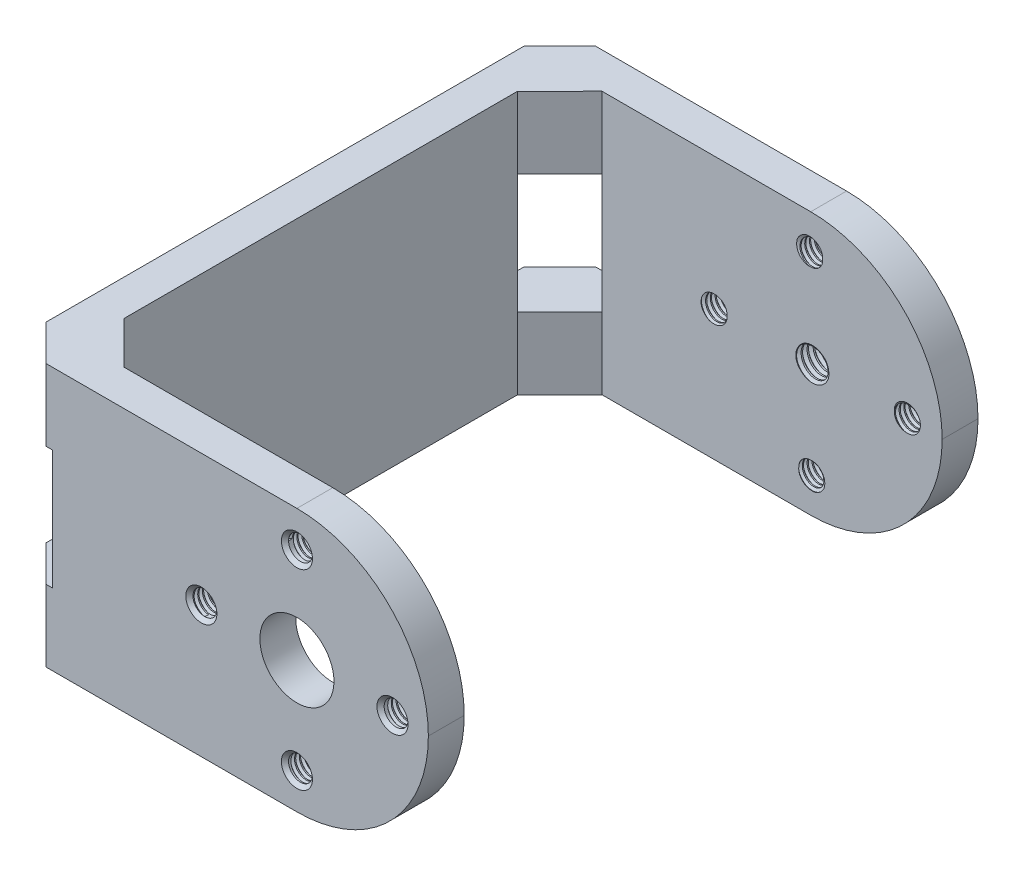
from build123d import *

# Parameters (mm, degrees)
IZIM1_W                                        = 46
IZIM1_H                                        = 22
Y_KSEKLIK_EKSTR_ZYON1_DEPTH                    = 35
IZIM2_W                                        = 40
IZIM2_H                                        = 22
KES_EKSTR_ZYON1_DEPTH                          = 32
RADYUS1_R                                      = 11
PAH1_SIZE                                      = 3
IZIM3_W                                        = 5
IZIM3_H                                        = 10
KES_EKSTR_ZYON2_DEPTH                          = 20
FEDER5_REACH                                   = 46.833
IZIM8_WALL_W                                   = 96.666047784
IZIM8_WALL_H                                   = 6
AYNALAMA4_COPY_1_REACH                         = 46.833
AYNALAMA4_COPY_1_SKETCH_W                      = 96.666047784
AYNALAMA4_COPY_1_SKETCH_H                      = 6
IZIM10_R                                       = 3.1
KES_EKSTR_ZYON4_DEPTH                          = 59.838762733
DI_1_PITCH                                     = 0.4
DAIRESEL_KAPLAMA1_COUNT                        = 4
DI_2_PITCH                                     = 0.4
DAIRESEL_KAPLAMA2_COUNT                        = 4
IZIM12_R                                       = 3.1
Y_KSEKLIK_EKSTR_ZYON3_DEPTH                    = 3
M3_D_Z_BA_L_MAKINE_VIDAS_IN_HAV_A1_D           = 2.5
M3_D_Z_BA_L_MAKINE_VIDAS_IN_HAV_A1_CSINK_D     = 3.1
M3_D_Z_BA_L_MAKINE_VIDAS_IN_HAV_A1_CSINK_ANGLE = 90
DI_4_PITCH                                     = 0.5


# Read off the part's stored shape, not the designer's step: M2 Düz Başlı Makine Vidası İçin Havşa1
with BuildPart() as part:
    # Çizim1 → Yükseklik-Ekstrüzyon1 (new body)
    with BuildSketch(Plane(origin=(0, 0, 0), x_dir=(0, 0, -1), z_dir=(1, 0, 0))):
        Rectangle(IZIM1_W, IZIM1_H)
    extrude(amount=Y_KSEKLIK_EKSTR_ZYON1_DEPTH)

    # Çizim2 → Kes-Ekstrüzyon1 (cut)
    with BuildSketch(Plane(origin=(35, 0, 0), x_dir=(0, 0, -1), z_dir=(1, 0, 0))):
        Rectangle(IZIM2_W, IZIM2_H)
    extrude(amount=-KES_EKSTR_ZYON1_DEPTH, mode=Mode.SUBTRACT)

    # Radyus1
    radyus1_edges = [part.edges().sort_by_distance(p)[0] for p in [
        (35, -11, 21.5),
        (35, 11, 21.5),
        (35, -11, -21.5),
        (35, 11, -21.5),
    ]]
    fillet(radyus1_edges, radius=RADYUS1_R - 0.0001)  # a hair under: the kernel refuses the full size

    # Pah1
    pah1_edges = [part.edges().sort_by_distance(p)[0] for p in [
        (0, 0, 23),
        (0, 0, -23),
    ]]
    chamfer(pah1_edges, length=PAH1_SIZE)

    # Çizim3 → Kes-Ekstrüzyon2 (cut)
    with BuildSketch(Plane(origin=(-10, 0, 10), x_dir=(0.7071067811865468, 0, 0.7071067811865483), z_dir=(-0.7071067811865483, 0, 0.7071067811865468))):
        with Locations((16.262135624, 0)):
            Rectangle(IZIM3_W, IZIM3_H)
    kes_ekstr_zyon2 = extrude(amount=-KES_EKSTR_ZYON2_DEPTH, mode=Mode.SUBTRACT)

    # M2 Düz Başlı Makine Vidası İçin Havşa1 ou → M2 Düz Başlı Makine Vidası İçin Havşa1 (revolve, cut)
    with BuildSketch(Plane(origin=(24, -8, 0), x_dir=(1, 0, 0), z_dir=(0, -1, 0))):
        Polygon((0, 20), (1, 20), (1, 22.7), (1.3, 23), (0, 23), align=None)
    m2_d_z_ba_l_makine_vidas_in_hav_a1 = revolve(axis=Axis((24, -8, 0), (0, 0, 1)), mode=Mode.SUBTRACT)

    # M2 D_z Ba_l_ Makine Vidas_ _in Hav_a 2 → M2 D_z Ba_l_ Makine Vidas_ _in Hav_a1 2 (revolve, cut)
    with BuildSketch(Plane(origin=(32, 0, 0), x_dir=(1, 0, 0), z_dir=(0, -1, 0))):
        Polygon((0, 20), (1, 20), (1, 22.7), (1.3, 23), (0, 23), align=None)
    m2_d_z_ba_l_makine_vidas_in_hav_a1_2 = revolve(axis=Axis((32, 0, 0), (0, 0, 1)), mode=Mode.SUBTRACT)

    # M2 D_z Ba_l_ Makine Vidas_ _in Hav_a 3 → M2 D_z Ba_l_ Makine Vidas_ _in Hav_a1 3 (revolve, cut)
    with BuildSketch(Plane(origin=(24, 8, 0), x_dir=(1, 0, 0), z_dir=(0, -1, 0))):
        Polygon((0, 20), (1, 20), (1, 22.7), (1.3, 23), (0, 23), align=None)
    m2_d_z_ba_l_makine_vidas_in_hav_a1_3 = revolve(axis=Axis((24, 8, 0), (0, 0, 1)), mode=Mode.SUBTRACT)

    # M2 D_z Ba_l_ Makine Vidas_ _in Hav_a 4 → M2 D_z Ba_l_ Makine Vidas_ _in Hav_a1 4 (revolve, cut)
    with BuildSketch(Plane(origin=(16, 0, 0), x_dir=(1, 0, 0), z_dir=(0, -1, 0))):
        Polygon((0, 20), (1, 20), (1, 22.7), (1.3, 23), (0, 23), align=None)
    m2_d_z_ba_l_makine_vidas_in_hav_a1_4 = revolve(axis=Axis((16, 0, 0), (0, 0, 1)), mode=Mode.SUBTRACT)

    # Aynalama2: Kes-Ekstrüzyon2, M2 Düz Başlı Makine Vidası İçin Havşa1, M2 D_z Ba_l_ Makine Vidas_ _in Hav_a1 2, M2 D_z Ba_l_ Makine Vidas_ _in Hav_a1 3, M2 D_z Ba_l_ Makine Vidas_ _in Hav_a1 4 across plane
    add(kes_ekstr_zyon2.mirror(Plane.XY), mode=Mode.SUBTRACT)
    add(m2_d_z_ba_l_makine_vidas_in_hav_a1.mirror(Plane.XY), mode=Mode.SUBTRACT)
    add(m2_d_z_ba_l_makine_vidas_in_hav_a1_2.mirror(Plane.XY), mode=Mode.SUBTRACT)
    add(m2_d_z_ba_l_makine_vidas_in_hav_a1_3.mirror(Plane.XY), mode=Mode.SUBTRACT)
    add(m2_d_z_ba_l_makine_vidas_in_hav_a1_4.mirror(Plane.XY), mode=Mode.SUBTRACT)

    # Çizim8 wall → Feder5 (add, up to next)
    with BuildSketch(Plane(origin=(4.766833329, -5, -18.231299423), x_dir=(-0.706733233022, 0, 0.707480132118), z_dir=(0.707480132118, 0, 0.706733233022)), mode=Mode.PRIVATE) as feder5_sk1:
        with Locations((0, 3)):
            Rectangle(IZIM8_WALL_W, IZIM8_WALL_H)
    feder5_tool1 = extrude(feder5_sk1.sketch, amount=-FEDER5_REACH, mode=Mode.PRIVATE) - part.part
    feder5 = feder5_tool1.solids().sort_by_distance((4.766833329, -5, -18.231299423))[0]
    add(feder5)

    # Aynalama3: Feder5 across plane
    add(feder5.mirror(Plane.ZX))

    # Aynalama4: Feder5 across plane
    add(feder5.mirror(Plane.XY))

    # Aynalama4 copy 1 sketch → Aynalama4 copy 1 (add, up to next)
    with BuildSketch(Plane(origin=(4.766833329, 5, 18.231299423), x_dir=(-0.706733233022, 0, -0.707480132118), z_dir=(0.707480132118, 0, -0.706733233022)), mode=Mode.PRIVATE) as aynalama4_copy_1_sk1:
        with Locations((0, 3)):
            Rectangle(AYNALAMA4_COPY_1_SKETCH_W, AYNALAMA4_COPY_1_SKETCH_H)
    aynalama4_copy_1_tool1 = extrude(aynalama4_copy_1_sk1.sketch, amount=-AYNALAMA4_COPY_1_REACH, mode=Mode.PRIVATE) - part.part
    add(aynalama4_copy_1_tool1.solids().sort_by_distance((4.766833329, 5, 18.231299423))[0])

    # Çizim10 → Kes-Ekstrüzyon4 (cut, through all)
    with BuildSketch(Plane(origin=(0, 0, -23), x_dir=(-1, 0, 0), z_dir=(0, 0, -1))):
        with Locations(Location((-24, 0, 0), (0, 0, 90))):
            Circle(IZIM10_R)
    extrude(amount=-KES_EKSTR_ZYON4_DEPTH, mode=Mode.SUBTRACT)

    # Diş1: the profile of Diş Profili1 profile screwed along a right-hand helix of 6.75 turns, 6 arcs to a turn; built about Z, then put on its axis
    di_1_z = Axis((0, 0, 0), (0, 0, 1))
    di_1_corners = [(0.9997, 0, -0.000173205), (1.21650635, 0, 0.124999999), (1.21650635, 0, 0.174999999), (0.9997, 0, 0.300173204)]
    with BuildLine(mode=Mode.PRIVATE) as di_1_profile:
        Line(di_1_corners[0], di_1_corners[1])
        Line(di_1_corners[1], di_1_corners[2])
        Line(di_1_corners[2], di_1_corners[3])
        Line(di_1_corners[3], di_1_corners[0])
    di_1_cap = Face(di_1_profile.wire())
    di_1_turn_angles = [0, 30, 60, 90, 120, 150, 180, 210, 240, 270, 300, 330, 360]
    di_1_turn_weights = [1, 0.8660254037844387, 1, 0.8660254037844387, 1, 0.8660254037844387, 1, 0.8660254037844387, 1, 0.8660254037844387, 1, 0.8660254037844387, 1]
    di_1_turn_rails = [Edge.make_bspline([Vector(p[0], p[1], 0).rotate(di_1_z, di_1_turn_angles[k]) / di_1_turn_weights[k] + Vector(0, 0, p[2] + DI_1_PITCH * di_1_turn_angles[k] / 360) for k in range(13)], [0, 0, 0, 1, 1, 2, 2, 3, 3, 4, 4, 5, 5, 6, 6, 6], 2, di_1_turn_weights) for p in di_1_corners]
    di_1_turn_sides = [Face.make_surface_from_curves(di_1_turn_rails[p[0]], di_1_turn_rails[p[1]]) for p in [(0, 1), (1, 2), (2, 3), (3, 0)]]
    di_1_last_angles = [2160, 2190, 2220, 2250, 2280, 2310, 2340, 2370, 2400, 2415, 2430]
    di_1_last_weights = [1, 0.8660254037844387, 1, 0.8660254037844387, 1, 0.8660254037844387, 1, 0.8660254037844387, 1, 0.9659258262890384, 1]
    di_1_last_rails = [Edge.make_bspline([Vector(p[0], p[1], 0).rotate(di_1_z, di_1_last_angles[k]) / di_1_last_weights[k] + Vector(0, 0, p[2] + DI_1_PITCH * di_1_last_angles[k] / 360) for k in range(11)], [0, 0, 0, 1, 1, 2, 2, 3, 3, 4, 4, 5, 5, 5], 2, di_1_last_weights) for p in di_1_corners]
    di_1_last_sides = [Face.make_surface_from_curves(di_1_last_rails[p[0]], di_1_last_rails[p[1]]) for p in [(0, 1), (1, 2), (2, 3), (3, 0)]]
    di_1 = Plane(origin=(24, 8, -22.7), x_dir=(1, 0, 0), z_dir=(0, 0, 1)) * Solid(Shell([*[p.moved(Location((0, 0, DI_1_PITCH * i))) for i in range(6) for p in di_1_turn_sides], *di_1_last_sides, di_1_cap, di_1_cap.rotate(di_1_z, 2430).moved(Location((0, 0, DI_1_PITCH * 2430 / 360)))]))
    add(di_1, mode=Mode.SUBTRACT)

    # Dairesel Kaplama1: Diş1 ×4 about axis
    dairesel_kaplama1_axis = Axis((24, 0, -20), (0, 0, -1))
    for i in range(1, DAIRESEL_KAPLAMA1_COUNT):
        add(di_1.rotate(dairesel_kaplama1_axis, i * 360 / DAIRESEL_KAPLAMA1_COUNT), mode=Mode.SUBTRACT)

    # Diş2: the profile of Diş Profili2 profile screwed along a right-hand helix of 6.75 turns, 6 arcs to a turn; built about Z, then put on its axis
    di_2_z = Axis((0, 0, 0), (0, 0, 1))
    di_2_corners = [(0.9997, 0, -0.000173205), (1.21650635, 0, 0.124999999), (1.21650635, 0, 0.174999999), (0.9997, 0, 0.300173204)]
    with BuildLine(mode=Mode.PRIVATE) as di_2_profile:
        Line(di_2_corners[0], di_2_corners[1])
        Line(di_2_corners[1], di_2_corners[2])
        Line(di_2_corners[2], di_2_corners[3])
        Line(di_2_corners[3], di_2_corners[0])
    di_2_cap = Face(di_2_profile.wire())
    di_2_turn_angles = [0, 30, 60, 90, 120, 150, 180, 210, 240, 270, 300, 330, 360]
    di_2_turn_weights = [1, 0.8660254037844387, 1, 0.8660254037844387, 1, 0.8660254037844387, 1, 0.8660254037844387, 1, 0.8660254037844387, 1, 0.8660254037844387, 1]
    di_2_turn_rails = [Edge.make_bspline([Vector(p[0], p[1], 0).rotate(di_2_z, di_2_turn_angles[k]) / di_2_turn_weights[k] + Vector(0, 0, p[2] + DI_2_PITCH * di_2_turn_angles[k] / 360) for k in range(13)], [0, 0, 0, 1, 1, 2, 2, 3, 3, 4, 4, 5, 5, 6, 6, 6], 2, di_2_turn_weights) for p in di_2_corners]
    di_2_turn_sides = [Face.make_surface_from_curves(di_2_turn_rails[p[0]], di_2_turn_rails[p[1]]) for p in [(0, 1), (1, 2), (2, 3), (3, 0)]]
    di_2_last_angles = [2160, 2190, 2220, 2250, 2280, 2310, 2340, 2370, 2400, 2415, 2430]
    di_2_last_weights = [1, 0.8660254037844387, 1, 0.8660254037844387, 1, 0.8660254037844387, 1, 0.8660254037844387, 1, 0.9659258262890519, 1]
    di_2_last_rails = [Edge.make_bspline([Vector(p[0], p[1], 0).rotate(di_2_z, di_2_last_angles[k]) / di_2_last_weights[k] + Vector(0, 0, p[2] + DI_2_PITCH * di_2_last_angles[k] / 360) for k in range(11)], [0, 0, 0, 1, 1, 2, 2, 3, 3, 4, 4, 5, 5, 5], 2, di_2_last_weights) for p in di_2_corners]
    di_2_last_sides = [Face.make_surface_from_curves(di_2_last_rails[p[0]], di_2_last_rails[p[1]]) for p in [(0, 1), (1, 2), (2, 3), (3, 0)]]
    di_2 = Plane(origin=(24, 8, 22.7), x_dir=(-1, 0, 0), z_dir=(0, 0, -1)) * Solid(Shell([*[p.moved(Location((0, 0, DI_2_PITCH * i))) for i in range(6) for p in di_2_turn_sides], *di_2_last_sides, di_2_cap, di_2_cap.rotate(di_2_z, 2430).moved(Location((0, 0, DI_2_PITCH * 2430 / 360)))]))
    add(di_2, mode=Mode.SUBTRACT)

    # Dairesel Kaplama2: Diş2 ×4 about axis
    dairesel_kaplama2_axis = Axis((24, 0, 23), (0, 0, -1))
    for i in range(1, DAIRESEL_KAPLAMA2_COUNT):
        add(di_2.rotate(dairesel_kaplama2_axis, i * 360 / DAIRESEL_KAPLAMA2_COUNT), mode=Mode.SUBTRACT)

    # Çizim12 → Yükseklik-Ekstrüzyon3 (add)
    with BuildSketch(Plane(origin=(0, 0, -23), x_dir=(-1, 0, 0), z_dir=(0, 0, -1))):
        with Locations(Location((-24, 0, 0), (0, 0, 90))):
            Circle(IZIM12_R)
    extrude(amount=-Y_KSEKLIK_EKSTR_ZYON3_DEPTH)

    # M3 Düz Başlı Makine Vidası İçin Havşa1 (through all)
    with Locations(Plane(origin=(24, 0, -23), x_dir=(0, -1, 0), z_dir=(0, 0, -1))):
        with Locations((0, 0)):
            CounterSinkHole(M3_D_Z_BA_L_MAKINE_VIDAS_IN_HAV_A1_D / 2, M3_D_Z_BA_L_MAKINE_VIDAS_IN_HAV_A1_CSINK_D / 2, counter_sink_angle=M3_D_Z_BA_L_MAKINE_VIDAS_IN_HAV_A1_CSINK_ANGLE)

    # Diş4: the profile of Diş Profili4 profile screwed along a right-hand helix of 5.4 turns, 6 arcs to a turn; built about Z, then put on its axis
    di_4_z = Axis((0, 0, 0), (0, 0, 1))
    di_4_corners = [(1.2497, 0, -0.000173205), (1.520632937, 0, 0.156249999), (1.520632937, 0, 0.218749999), (1.2497, 0, 0.375173204)]
    with BuildLine(mode=Mode.PRIVATE) as di_4_profile:
        Line(di_4_corners[0], di_4_corners[1])
        Line(di_4_corners[1], di_4_corners[2])
        Line(di_4_corners[2], di_4_corners[3])
        Line(di_4_corners[3], di_4_corners[0])
    di_4_cap = Face(di_4_profile.wire())
    di_4_turn_angles = [0, 30, 60, 90, 120, 150, 180, 210, 240, 270, 300, 330, 360]
    di_4_turn_weights = [1, 0.8660254037844387, 1, 0.8660254037844387, 1, 0.8660254037844387, 1, 0.8660254037844387, 1, 0.8660254037844387, 1, 0.8660254037844387, 1]
    di_4_turn_rails = [Edge.make_bspline([Vector(p[0], p[1], 0).rotate(di_4_z, di_4_turn_angles[k]) / di_4_turn_weights[k] + Vector(0, 0, p[2] + DI_4_PITCH * di_4_turn_angles[k] / 360) for k in range(13)], [0, 0, 0, 1, 1, 2, 2, 3, 3, 4, 4, 5, 5, 6, 6, 6], 2, di_4_turn_weights) for p in di_4_corners]
    di_4_turn_sides = [Face.make_surface_from_curves(di_4_turn_rails[p[0]], di_4_turn_rails[p[1]]) for p in [(0, 1), (1, 2), (2, 3), (3, 0)]]
    di_4_last_angles = [1800, 1830, 1860, 1890, 1920, 1932, 1944]
    di_4_last_weights = [1, 0.8660254037844387, 1, 0.8660254037844387, 1, 0.9781476007338044, 1]
    di_4_last_rails = [Edge.make_bspline([Vector(p[0], p[1], 0).rotate(di_4_z, di_4_last_angles[k]) / di_4_last_weights[k] + Vector(0, 0, p[2] + DI_4_PITCH * di_4_last_angles[k] / 360) for k in range(7)], [0, 0, 0, 1, 1, 2, 2, 3, 3, 3], 2, di_4_last_weights) for p in di_4_corners]
    di_4_last_sides = [Face.make_surface_from_curves(di_4_last_rails[p[0]], di_4_last_rails[p[1]]) for p in [(0, 1), (1, 2), (2, 3), (3, 0)]]
    di_4 = Plane(origin=(24, 0, -22.7), x_dir=(1, 0, 0), z_dir=(0, 0, 1)) * Solid(Shell([*[p.moved(Location((0, 0, DI_4_PITCH * i))) for i in range(5) for p in di_4_turn_sides], *di_4_last_sides, di_4_cap, di_4_cap.rotate(di_4_z, 1944).moved(Location((0, 0, DI_4_PITCH * 1944 / 360)))]))
    add(di_4, mode=Mode.SUBTRACT)


solid = part.part
